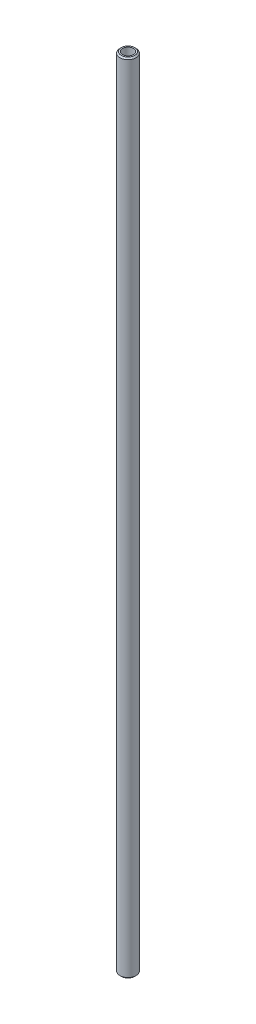
from build123d import *

# Parameters (mm, degrees)
ESQUISSE2_R        = 3
ESQUISSE2_R_2      = 2
BOSS_EXTRU_1_DEPTH = 295
CHANFREIN1_SIZE    = 0.5


with BuildPart() as part:
    # Esquisse2 → Boss.-Extru.1 (new body)
    with BuildSketch(Plane(origin=(0, 0, 0), x_dir=(1, 0, 0), z_dir=(0, 1, 0))):
        with Locations((5628.342775437, -596.213783271)):
            Circle(ESQUISSE2_R)
        with Locations((5628.342775437, -596.213783271)):
            Circle(ESQUISSE2_R_2, mode=Mode.SUBTRACT)
    extrude(amount=BOSS_EXTRU_1_DEPTH)

    # Chanfrein1
    chanfrein1_edges = [part.edges().sort_by_distance(p)[0] for p in [
        (5625.342775437, 295, 596.213783271),
        (5625.342775437, 0, 596.213783271),
    ]]
    chamfer(chanfrein1_edges, length=CHANFREIN1_SIZE)


solid = part.part
